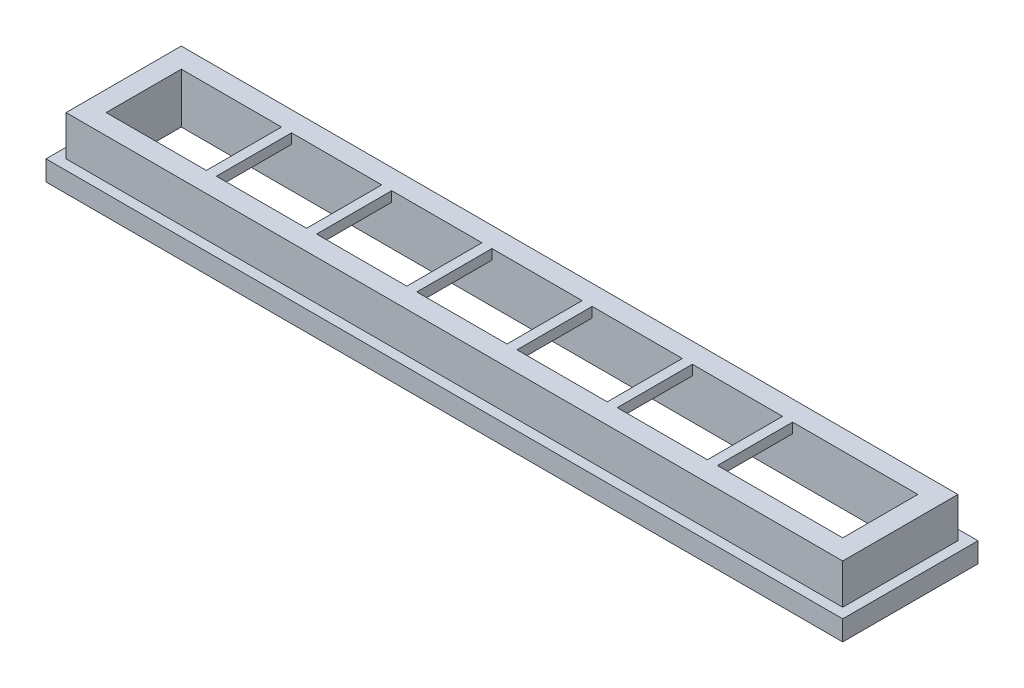
from build123d import *

# Parameters (mm, degrees)
SKIZZE1_W                            = 155
SKIZZE1_H                            = 23
SKIZZE1_W_2                          = 147
SKIZZE1_H_2                          = 15
AUFSATZ_LINEAR_AUSTRAGEN1_DEPTH      = 10
SKIZZE2_W                            = 2
SKIZZE2_H                            = 15
AUFSATZ_LINEAR_AUSTRAGEN2_DEPTH      = 2
AUFSATZ_LINEAR_AUSTRAGEN3_DEPTH      = 2
AUFSATZ_LINEAR_AUSTRAGEN3_DEPTH_BACK = 2
SKIZZE3_W                            = 159
SKIZZE3_H                            = 27
SKIZZE3_W_2                          = 155
SKIZZE3_H_2                          = 23


with BuildPart() as part:
    # Skizze1 → Aufsatz-Linear austragen1 (new body)
    with BuildSketch(Plane(origin=(0, 0, 0), x_dir=(1, 0, 0), z_dir=(0, 1, 0))):
        Rectangle(SKIZZE1_W, SKIZZE1_H)
        Rectangle(SKIZZE1_W_2, SKIZZE1_H_2, mode=Mode.SUBTRACT)
    extrude(amount=AUFSATZ_LINEAR_AUSTRAGEN1_DEPTH)

    # Skizze2 → Aufsatz-Linear austragen2 (add)
    with BuildSketch(Plane(origin=(0, 10, 0), x_dir=(1, 0, 0), z_dir=(0, 1, 0))):
        with Locations((-52.5, 0)):
            Rectangle(SKIZZE2_W, SKIZZE2_H)
        with Locations((-32.5, 0)):
            Rectangle(SKIZZE2_W, SKIZZE2_H)
        with Locations((-12.5, 0)):
            Rectangle(SKIZZE2_W, SKIZZE2_H)
        with Locations((7.5, 0)):
            Rectangle(SKIZZE2_W, SKIZZE2_H)
        with Locations((27.5, 0)):
            Rectangle(SKIZZE2_W, SKIZZE2_H)
        with Locations((47.5, 0)):
            Rectangle(SKIZZE2_W, SKIZZE2_H)
    extrude(amount=-AUFSATZ_LINEAR_AUSTRAGEN2_DEPTH)

    # Skizze3 → Aufsatz-Linear austragen3 (add, two sides: drawn at the far end of the back side and taken through both)
    with BuildSketch(Plane.XZ.offset(-AUFSATZ_LINEAR_AUSTRAGEN3_DEPTH_BACK)):
        Rectangle(SKIZZE3_W, SKIZZE3_H)
        Rectangle(SKIZZE3_W_2, SKIZZE3_H_2, mode=Mode.SUBTRACT)
    extrude(amount=AUFSATZ_LINEAR_AUSTRAGEN3_DEPTH + AUFSATZ_LINEAR_AUSTRAGEN3_DEPTH_BACK)


solid = part.part
